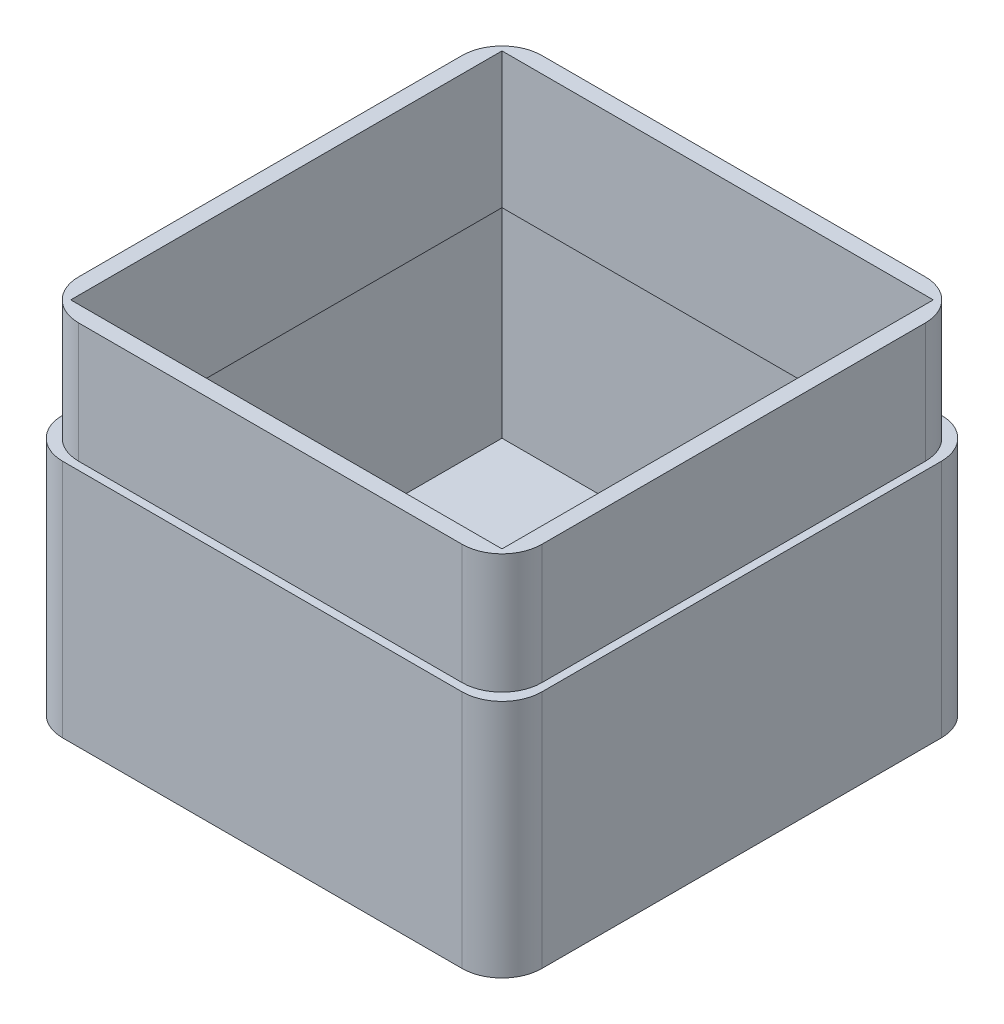
from build123d import *

# Parameters (mm, degrees)
SKETCH1_W           = 120
SKETCH1_H           = 120
BOSS_EXTRUDE1_DEPTH = 90
SKETCH4_W           = 120
SKETCH4_H           = 120
SKETCH4_W_2         = 116
SKETCH4_H_2         = 116
CUT_EXTRUDE1_DEPTH  = 30
SHELL2_T            = -4
FILLET2_R           = 10


with BuildPart() as part:
    # Sketch1 → Boss-Extrude1 (new body)
    with BuildSketch(Plane(origin=(0, 0, 0), x_dir=(1, 0, 0), z_dir=(0, 1, 0))):
        with Locations((3.054044677, -35.213712114)):
            Rectangle(SKETCH1_W, SKETCH1_H)
    extrude(amount=BOSS_EXTRUDE1_DEPTH)

    # Sketch4 → Cut-Extrude1 (cut)
    with BuildSketch(Plane(origin=(0, 90, 0), x_dir=(1, 0, 0), z_dir=(0, 1, 0))):
        with Locations((3.054044677, -35.213712114)):
            Rectangle(SKETCH4_W, SKETCH4_H)
        with Locations((3.054044677, -35.213712114)):
            Rectangle(SKETCH4_W_2, SKETCH4_H_2, mode=Mode.SUBTRACT)
    extrude(amount=-CUT_EXTRUDE1_DEPTH, mode=Mode.SUBTRACT)

    # Shell2
    shell2_openings = [part.faces().sort_by_distance(p)[0] for p in [
        (3.054044677, 90, 35.213712114),
    ]]
    offset(amount=SHELL2_T, openings=shell2_openings, kind=Kind.INTERSECTION)

    # Fillet2
    fillet2_edges = [part.edges().sort_by_distance(p)[0] for p in [
        (61.054044677, 75, 93.213712114),
        (63.054044677, 30, 95.213712114),
        (-56.945955323, 30, 95.213712114),
        (-54.945955323, 75, 93.213712114),
        (-54.945955323, 75, -22.786287886),
        (-56.945955323, 30, -24.786287886),
        (61.054044677, 75, -22.786287886),
        (63.054044677, 30, -24.786287886),
    ]]
    fillet(fillet2_edges, radius=FILLET2_R)


solid = part.part
